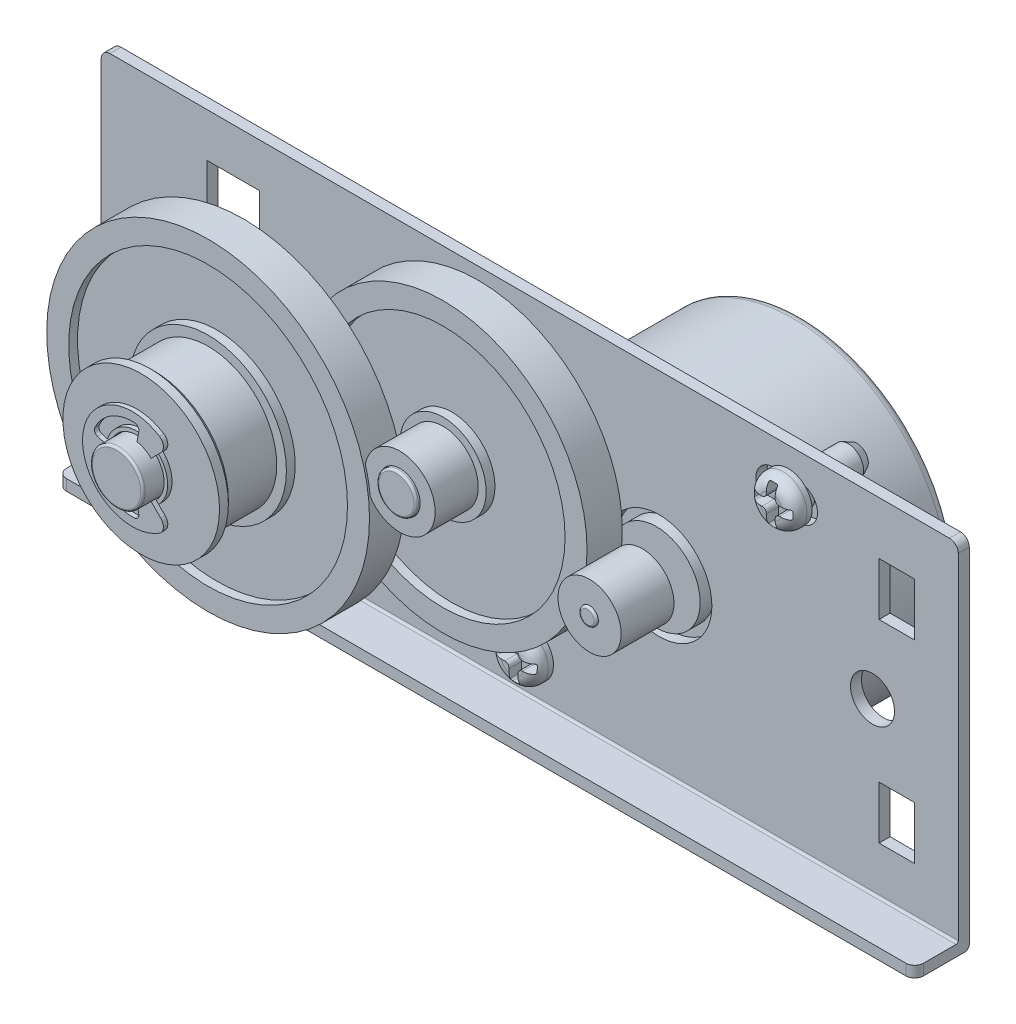
from build123d import *
from OCP.BRepFilletAPI import BRepFilletAPI_MakeChamfer

# Parameters (mm, degrees)
ESBO_O1_W                  = 97.4
ESBO_O1_H                  = 1.25
RESSALTO_EXTRUS_O1_DEPTH   = 6.2
ESBO_O2_W                  = 97.4
ESBO_O2_H                  = 1.25
RESSALTO_EXTRUS_O2_DEPTH   = 40.6
FILETE1_R                  = 1
ESBO_O3_R                  = 2
ESBO_O3_R_2                = 2.5
ESBO_O3_R_3                = 6
ESBO_O3_W                  = 4
ESBO_O3_H                  = 6
ESBO_O3_W_2                = 6
ESBO_O3_H_2                = 8
CORTE_EXTRUS_O1_DEPTH      = 40.6
ESBO_O6_R                  = 3
RESSALTO_EXTRUS_O3_DEPTH   = 22.5
ESBO_O7_R                  = 2.25
RESSALTO_EXTRUS_O4_DEPTH   = 12.3
FILETE2_R                  = 0.25
ESBO_O12_R                 = 4
RESSALTO_EXTRUS_O7_DEPTH   = 3
ESBO_O13_R                 = 4.5
RESSALTO_EXTRUS_O8_DEPTH   = 8.1
ESBO_O8_R                  = 16.365
ESBO_O8_R_2                = 2.3
RESSALTO_EXTRUS_O5_DEPTH   = 4
ESBO_O9_R                  = 4
ESBO_O9_R_2                = 2.3
RESSALTO_EXTRUS_O6_DEPTH   = 8.9
ESBO_O10_R                 = 13.865
ESBO_O10_R_2               = 4.9
CORTE_EXTRUS_O2_DEPTH      = 1
CORTE_EXTRUS_O3_START      = -1
ESBO_O11_R                 = 13.86
ESBO_O11_R_2               = 4.9
CORTE_EXTRUS_O3_DEPTH      = 1
ESBO_O14_R                 = 18.34
ESBO_O14_R_2               = 3.1
RESSALTO_EXTRUS_O9_DEPTH   = 4
ESBO_O15_R                 = 7.8
ESBO_O15_R_2               = 3.1
RESSALTO_EXTRUS_O10_DEPTH  = 11.6
RESSALTO_EXTRUS_O11_START  = -1.5
ESBO_O16_R                 = 8.9
ESBO_O16_R_2               = 3.1
RESSALTO_EXTRUS_O11_DEPTH  = 1.5
CHANFRO1_SIZE              = 0.5
ESBO_O17_R                 = 3.5
ESBO_O17_R_2               = 3.1
RESSALTO_EXTRUS_O12_DEPTH  = 0.5
CORTE_EXTRUS_O4_START      = -1
ESBO_O18_R                 = 15.84
ESBO_O18_R_2               = 8.9
CORTE_EXTRUS_O4_DEPTH      = 1
ESBO_O19_R                 = 15.825
ESBO_O19_R_2               = 8.9
CORTE_EXTRUS_O5_DEPTH      = 1
RESSALTO_EXTRUS_O13_DEPTH  = 0.5
ESBO_O21_R                 = 1.75
RESSALTO_EXTRUS_O14_DEPTH  = 0.92
ESBO_O23_R                 = 17.675026778
RESSALTO_EXTRUS_O15_DEPTH  = 15
FILETE4_R                  = 1
ESBO_O24_R                 = 2.05
ESBO_O24_R_2               = 1.75
RESSALTO_EXTRUS_O16_DEPTH  = 1
ESBO_O25_R                 = 2.5
RESSALTO_EXTRUS_O17_DEPTH  = 0.1
ESBO_O26_R                 = 1
RESSALTO_EXTRUS_O18_DEPTH  = 0.5
FILETE6_R                  = 0.1
ESBO_O27_R                 = 4.99
RESSALTO_EXTRUS_O19_DEPTH  = 16.57
RESSALTO_EXTRUS_O20_START  = -25
ESBO_O28_R                 = 1
RESSALTO_EXTRUS_O20_DEPTH  = 25
FILETE5_R                  = 0.25
ESBO_O29_R                 = 3.59
RESSALTO_EXTRUS_O21_DEPTH  = 6
ESBO_O30_R                 = 2.7
RESSALTO_EXTRUS_O22_DEPTH  = 2
FILETE7_R                  = 1.4
CORTE_EXTRUS_O6_DEPTH      = 1.4
ESBO_O32_R                 = 1.75
RESSALTO_EXTRUS_O23_DEPTH  = 7.8
CHANFRO2_SIZE              = 1
CHANFRO2_SIZE2             = 0.466307658
RESSALTO_EXTRUS_O24_DEPTH  = 10
ESBO_O34_R                 = 2
RESSALTO_EXTRUS_O25_DEPTH  = 5
ESBO_O35_R                 = 7.8
RESSALTO_EXTRUS_O26_DEPTH  = 7.6
ESBO_O37_R                 = 8.9
RESSALTO_EXTRUS_O27_DEPTH  = 1.5
CHANFRO3_SIZE              = 0.5
ESBO_O38_R                 = 8.9
RESSALTO_EXTRUS_O28_DEPTH  = 1.5
CORTE_EXTRUS_O7_DEPTH      = 16
CORTE_EXTRUS_O7_DEPTH_BACK = 35.5
ESBO_O39_R                 = 3.05
ESBO_O40_R                 = 4
RESSALTO_EXTRUS_O29_DEPTH  = 6
ESBO_O41_R                 = 3
RESSALTO_EXTRUS_O30_DEPTH  = 18.5
FILETE8_R                  = 0.25
RESSALTO_EXTRUS_O31_DEPTH  = 0.5
RESSALTO_EXTRUS_O32_DEPTH  = 1.2
FILETE9_R                  = 2
FILETE10_R                 = 0.3
FILETE11_R                 = 0.5
FILETE12_R                 = 0.25


with BuildPart() as part:
    # Esboço1 → Ressalto-extrusão1 (new body)
    with BuildSketch(Plane.XY):
        Rectangle(ESBO_O1_W, ESBO_O1_H)
    extrude(amount=RESSALTO_EXTRUS_O1_DEPTH)

    # Esboço2 → Ressalto-extrusão2 (add)
    with BuildSketch(Plane(origin=(0, -0.625, 0), x_dir=(1, 0, 0), z_dir=(0, 1, 0))):
        with Locations((0, -0.625)):
            Rectangle(ESBO_O2_W, ESBO_O2_H)
    extrude(amount=RESSALTO_EXTRUS_O2_DEPTH)

    # Filete1
    filete1_edges = [part.edges().sort_by_distance(p)[0] for p in [
        (48.7, 0, 6.2),
        (48.7, 39.975, 0.625),
        (-48.7, 39.975, 0.625),
        (-48.7, 0, 6.2),
    ]]
    fillet(filete1_edges, radius=FILETE1_R)

    # Esboço3 → Corte-extrusão1 (cut)
    with BuildSketch(Plane.XY.offset(1.25)):
        with Locations((-43.7, 4.975)):
            Circle(ESBO_O3_R)
        with Locations((0, 4.975)):
            Circle(ESBO_O3_R)
        with Locations((38.95, 19.8)):
            Circle(ESBO_O3_R_2)
        with Locations((14.7, 19.8)):
            Circle(ESBO_O3_R_3)
        with Locations((41.7, 30.975)):
            Rectangle(ESBO_O3_W, ESBO_O3_H)
        with Locations((41.7, 8.975)):
            Rectangle(ESBO_O3_W, ESBO_O3_H)
        with Locations((-33.7, 8.975)):
            Rectangle(ESBO_O3_W_2, ESBO_O3_H_2)
        with BuildLine():
            Line((27.7, 36.975), (30.7, 36.975))
            ThreePointArc((30.7, 36.975), (32.7, 34.975), (30.7, 32.975))
            Line((30.7, 32.975), (27.7, 32.975))
            ThreePointArc((27.7, 32.975), (25.7, 34.975), (27.7, 36.975))
        make_face()
        with Locations((-33.7, 30.975)):
            Rectangle(ESBO_O3_W_2, ESBO_O3_H_2)
    extrude(amount=-CORTE_EXTRUS_O1_DEPTH, mode=Mode.SUBTRACT)

    # Esboço6 → Ressalto-extrusão3 (add)
    with BuildSketch(Plane(origin=(0, 0, 0), x_dir=(-1, 0, 0), z_dir=(0, 0, -1))):
        with Locations((25.7, 19.8)):
            Circle(ESBO_O6_R)
    extrude(amount=-RESSALTO_EXTRUS_O3_DEPTH)

    # Esboço7 → Ressalto-extrusão4 (add)
    with BuildSketch(Plane(origin=(0, 0, 0), x_dir=(-1, 0, 0), z_dir=(0, 0, -1))):
        with Locations((4.1, 23.975)):
            Circle(ESBO_O7_R)
    extrude(amount=-RESSALTO_EXTRUS_O4_DEPTH)

    # Filete2
    filete2_edges = [part.edges().sort_by_distance(p)[0] for p in [
        (-22.7, 19.8, 22.5),
        (-1.85, 23.975, 12.3),
    ]]
    fillet(filete2_edges, radius=FILETE2_R)

    # Esboço12 → Ressalto-extrusão7 (add)
    with BuildSketch(Plane.XY):
        with Locations(Location((-4.1, 23.975, 0), (0, 0, 180))):
            Circle(ESBO_O12_R)
    extrude(amount=RESSALTO_EXTRUS_O7_DEPTH)

    # Esboço13 → Ressalto-extrusão8 (add)
    with BuildSketch(Plane(origin=(0, 0, 0), x_dir=(-1, 0, 0), z_dir=(0, 0, -1))):
        with Locations((25.7, 19.8)):
            Circle(ESBO_O13_R)
    extrude(amount=-RESSALTO_EXTRUS_O8_DEPTH)

    # Esboço8 → Ressalto-extrusão5 (add)
    with BuildSketch(Plane.XY.offset(3)):
        with Locations((-4.1, 23.975)):
            Circle(ESBO_O8_R)
        with Locations((-4.1, 23.975)):
            Circle(ESBO_O8_R_2, mode=Mode.SUBTRACT)
    extrude(amount=RESSALTO_EXTRUS_O5_DEPTH)

    # Esboço9 → Ressalto-extrusão6 (add)
    with BuildSketch(Plane.XY.offset(3)):
        with Locations(Location((-4.1, 23.975, 0), (0, 0, 180))):
            Circle(ESBO_O9_R)
        with Locations((-4.1, 23.975)):
            Circle(ESBO_O9_R_2, mode=Mode.SUBTRACT)
    extrude(amount=RESSALTO_EXTRUS_O6_DEPTH)

    # Esboço10 → Corte-extrusão2 (cut)
    with BuildSketch(Plane.XY.offset(7)):
        with Locations((-4.1, 23.975)):
            Circle(ESBO_O10_R)
        with Locations((-4.1, 23.975)):
            Circle(ESBO_O10_R_2, mode=Mode.SUBTRACT)
    extrude(amount=-CORTE_EXTRUS_O2_DEPTH, mode=Mode.SUBTRACT)

    # Esboço11 → Corte-extrusão3 (cut)
    with BuildSketch(Plane(origin=(0, 0, 3), x_dir=(-1, 0, 0), z_dir=(0, 0, -1)).offset(CORTE_EXTRUS_O3_START)):
        with Locations((4.1, 23.975)):
            Circle(ESBO_O11_R)
        with Locations(Location((4.1, 23.975, 0), (0, 0, 180))):
            Circle(ESBO_O11_R_2, mode=Mode.SUBTRACT)
    extrude(amount=CORTE_EXTRUS_O3_DEPTH, mode=Mode.SUBTRACT)

    # Esboço14 → Ressalto-extrusão9 (add)
    with BuildSketch(Plane.XY.offset(8.1)):
        with Locations(Location((-25.7, 19.8, 0), (0, 0, 15.545528491))):
            Circle(ESBO_O14_R)
        with Locations((-25.7, 19.8)):
            Circle(ESBO_O14_R_2, mode=Mode.SUBTRACT)
    extrude(amount=RESSALTO_EXTRUS_O9_DEPTH)

    # Esboço15 → Ressalto-extrusão10 (add)
    with BuildSketch(Plane.XY.offset(8.1)):
        with Locations((-25.7, 19.8)):
            Circle(ESBO_O15_R)
        with Locations((-25.7, 19.8)):
            Circle(ESBO_O15_R_2, mode=Mode.SUBTRACT)
    extrude(amount=RESSALTO_EXTRUS_O10_DEPTH)

    # Esboço16 → Ressalto-extrusão11 (add)
    with BuildSketch(Plane.XY.offset(19.7).offset(RESSALTO_EXTRUS_O11_START)):
        with Locations((-25.7, 19.8)):
            Circle(ESBO_O16_R)
        with Locations((-25.7, 19.8)):
            Circle(ESBO_O16_R_2, mode=Mode.SUBTRACT)
    extrude(amount=RESSALTO_EXTRUS_O11_DEPTH)

    # Chanfro1
    chanfro1_edges = [part.edges().sort_by_distance(p)[0] for p in [
        (-34.6, 19.8, 18.2),
    ]]
    chamfer(chanfro1_edges, length=CHANFRO1_SIZE)

    # Esboço17 → Ressalto-extrusão12 (add)
    with BuildSketch(Plane.XY.offset(19.7)):
        with Locations((-25.7, 19.8)):
            Circle(ESBO_O17_R)
        with Locations((-25.7, 19.8)):
            Circle(ESBO_O17_R_2, mode=Mode.SUBTRACT)
    extrude(amount=RESSALTO_EXTRUS_O12_DEPTH)

    # Esboço18 → Corte-extrusão4 (cut)
    with BuildSketch(Plane.XY.offset(12.1).offset(CORTE_EXTRUS_O4_START)):
        with Locations((-25.7, 19.8)):
            Circle(ESBO_O18_R)
        with Locations((-25.7, 19.8)):
            Circle(ESBO_O18_R_2, mode=Mode.SUBTRACT)
    extrude(amount=CORTE_EXTRUS_O4_DEPTH, mode=Mode.SUBTRACT)

    # Esboço19 → Corte-extrusão5 (cut)
    with BuildSketch(Plane(origin=(0, 0, 8.1), x_dir=(-1, 0, 0), z_dir=(0, 0, -1))):
        with Locations((25.7, 19.8)):
            Circle(ESBO_O19_R)
        with Locations(Location((25.7, 19.8, 0), (0, 0, 180))):
            Circle(ESBO_O19_R_2, mode=Mode.SUBTRACT)
    extrude(amount=-CORTE_EXTRUS_O5_DEPTH, mode=Mode.SUBTRACT)

    # Esboço20 → Ressalto-extrusão13 (add)
    with BuildSketch(Plane.XY.offset(20.2)):
        with BuildLine():
            Line((-28.322721615, 20.626940949), (-29.67498238, 21.05330713))
            ThreePointArc((-29.67498238, 21.05330713), (-29.981119219, 21.326162864), (-29.980184512, 21.736247175))
            ThreePointArc((-29.980184512, 21.736247175), (-28.137076875, 23.816178393), (-25.441102958, 24.490629478))
            ThreePointArc((-25.441102958, 24.490629478), (-25.076922131, 24.302102712), (-24.9762544, 23.904565262))
            Line((-24.9762544, 23.904565262), (-25.222467511, 22.508221321))
            ThreePointArc((-25.222467511, 22.508221321), (-24.430191314, 22.239279791), (-23.755456352, 21.744543648))
            Line((-23.755456352, 21.744543648), (-22.474650348, 23.025349652))
            ThreePointArc((-22.474650348, 23.025349652), (-22.187573749, 23.840156974), (-22.642480013, 24.574584803))
            ThreePointArc((-22.642480013, 24.574584803), (-31.36966388, 19.8), (-22.642480013, 15.025415197))
            ThreePointArc((-22.642480013, 15.025415197), (-22.187573749, 15.759843026), (-22.474650348, 16.574650348))
            Line((-22.474650348, 16.574650348), (-23.755456352, 17.855456352))
            ThreePointArc((-23.755456352, 17.855456352), (-24.430191314, 17.360720209), (-25.222467511, 17.091778679))
            Line((-25.222467511, 17.091778679), (-24.9762544, 15.695434738))
            ThreePointArc((-24.9762544, 15.695434738), (-25.076922131, 15.297897288), (-25.441102958, 15.109370522))
            ThreePointArc((-25.441102958, 15.109370522), (-28.137076875, 15.783821607), (-29.980184512, 17.863752825))
            ThreePointArc((-29.980184512, 17.863752825), (-29.981119219, 18.273837136), (-29.67498238, 18.54669287))
            Line((-29.67498238, 18.54669287), (-28.322721615, 18.973059051))
            ThreePointArc((-28.322721615, 18.973059051), (-28.45, 19.8), (-28.322721615, 20.626940949))
        make_face()
    extrude(amount=RESSALTO_EXTRUS_O13_DEPTH)

    # Esboço21 → Ressalto-extrusão14 (add)
    with BuildSketch(Plane(origin=(0, 0, 0), x_dir=(-1, 0, 0), z_dir=(0, 0, -1))):
        with BuildLine():
            Line((3.595164465, 5.161527392), (2.779555471, 20.88173038))
            ThreePointArc((2.779555471, 20.88173038), (-2.196938457, 32.222448714), (-13.433733778, 37.429349428))
            Line((-13.433733778, 37.429349428), (-29.134017665, 38.565609025))
            ThreePointArc((-29.134017665, 38.565609025), (-31.845866586, 37.610857858), (-32.993876913, 34.975))
            Line((-32.993876913, 34.975), (-32.993876913, 30.076020514))
            Line((-32.993876913, 30.076020514), (-30.487753652, 27.518219171))
            ThreePointArc((-30.487753652, 27.518219171), (-27.196938457, 7.727551286), (-7.477551833, 4.033530282))
            Line((-7.477551833, 4.033530282), (-4.87273477, 1.375))
            Line((-4.87273477, 1.375), (0, 1.375))
            ThreePointArc((0, 1.375), (2.610699007, 2.49624009), (3.595164465, 5.161527392))
        make_face()
        with Locations((0, 4.975)):
            Circle(ESBO_O21_R, mode=Mode.SUBTRACT)
        with Locations((-29.393876913, 34.975)):
            Circle(ESBO_O21_R, mode=Mode.SUBTRACT)
    extrude(amount=RESSALTO_EXTRUS_O14_DEPTH)

    # Esboço23 → Ressalto-extrusão15 (add)
    with BuildSketch(Plane.XY):
        with Locations((14.7, 19.8)):
            Circle(ESBO_O23_R)
    extrude(amount=-RESSALTO_EXTRUS_O15_DEPTH)

    # Filete4
    filete4_edges = [part.edges().sort_by_distance(p)[0] for p in [
        (-2.975026778, 19.8, -15),
    ]]
    fillet(filete4_edges, radius=FILETE4_R)

    # Esboço24 → Ressalto-extrusão16 (add)
    # profile 1 of 2: a face of its own
    with BuildSketch(Plane(origin=(0, 0, -0.92), x_dir=(-1, 0, 0), z_dir=(0, 0, -1))):
        with Locations((0, 4.975)):
            Circle(ESBO_O24_R)
        with Locations((0, 4.975)):
            Circle(ESBO_O24_R_2, mode=Mode.SUBTRACT)
    # profile 2 of 2: a face of its own
    with BuildSketch(Plane(origin=(0, 0, -0.92), x_dir=(-1, 0, 0), z_dir=(0, 0, -1))):
        with Locations((-29.393876913, 34.975)):
            Circle(ESBO_O24_R)
        with Locations((-29.393876913, 34.975)):
            Circle(ESBO_O24_R_2, mode=Mode.SUBTRACT)
    extrude(amount=RESSALTO_EXTRUS_O16_DEPTH)

    # Esboço25 → Ressalto-extrusão17 (add)
    with BuildSketch(Plane(origin=(0, 0, -15), x_dir=(-1, 0, 0), z_dir=(0, 0, -1))):
        with Locations(Location((-14.7, 19.8, 0), (0, 0, 180))):
            Circle(ESBO_O25_R)
    extrude(amount=RESSALTO_EXTRUS_O17_DEPTH)

    # Esboço26 → Ressalto-extrusão18 (add)
    with BuildSketch(Plane(origin=(0, 0, -15.1), x_dir=(-1, 0, 0), z_dir=(0, 0, -1))):
        with Locations((-14.7, 19.8)):
            Circle(ESBO_O26_R)
    extrude(amount=RESSALTO_EXTRUS_O18_DEPTH)

    # Filete6
    filete6_edges = [part.edges().sort_by_distance(p)[0] for p in [
        (12.2, 19.8, -15.1),
    ]]
    fillet(filete6_edges, radius=FILETE6_R - 0.0001)  # a hair under: the kernel refuses the full size

    # Esboço27 → Ressalto-extrusão19 (add)
    with BuildSketch(Plane.XY.offset(-15)):
        with Locations(Location((14.7, 19.8, 0), (0, 0, 180))):
            Circle(ESBO_O27_R)
    extrude(amount=RESSALTO_EXTRUS_O19_DEPTH)

    # Esboço28 → Ressalto-extrusão20 (add)
    with BuildSketch(Plane(origin=(0, 0, -15.6), x_dir=(-1, 0, 0), z_dir=(0, 0, -1)).offset(RESSALTO_EXTRUS_O20_START)):
        with Locations((-14.7, 19.8)):
            Circle(ESBO_O28_R)
    extrude(amount=RESSALTO_EXTRUS_O20_DEPTH)

    # Filete5
    filete5_edges = [part.edges().sort_by_distance(p)[0] for p in [
        (15.7, 19.8, -15.6),
        (15.7, 19.8, 9.4),
    ]]
    fillet(filete5_edges, radius=FILETE5_R)

    # Esboço29 → Ressalto-extrusão21 (add)
    with BuildSketch(Plane.XY.offset(9.15)):
        with Locations((14.7, 19.8)):
            Circle(ESBO_O29_R)
    extrude(amount=-RESSALTO_EXTRUS_O21_DEPTH)

    # Esboço30 → Ressalto-extrusão22 (add)
    with BuildSketch(Plane.XY.offset(1.25)):
        with Locations(Location((0, 4.975, 0), (0, 0, 180))):
            Circle(ESBO_O30_R)
        with Locations(Location((29.393876913, 34.975, 0), (0, 0, 227.672748848))):
            Circle(ESBO_O30_R)
    extrude(amount=RESSALTO_EXTRUS_O22_DEPTH)

    # Filete7
    filete7_edges = [part.edges().sort_by_distance(p)[0] for p in [
        (2.7, 4.975, 3.25),
        (31.211960314, 36.971139461, 3.25),
    ]]
    fillet(filete7_edges, radius=FILETE7_R)

    # Esboço31 → Corte-extrusão6 (cut)
    with BuildSketch(Plane.XY.offset(3.25)):
        with BuildLine():
            Line((29.093876913, 37.175), (29.693876913, 37.175))
            ThreePointArc((29.693876913, 37.175), (29.83529827, 37.116421356), (29.893876913, 36.975))
            Line((29.893876913, 36.975), (29.893876913, 35.975))
            ThreePointArc((29.893876913, 35.975), (30.040323523, 35.621446609), (30.393876913, 35.475))
            Line((30.393876913, 35.475), (31.393876913, 35.475))
            ThreePointArc((31.393876913, 35.475), (31.53529827, 35.416421356), (31.593876913, 35.275))
            Line((31.593876913, 35.275), (31.593876913, 34.675))
            ThreePointArc((31.593876913, 34.675), (31.53529827, 34.533578644), (31.393876913, 34.475))
            Line((31.393876913, 34.475), (30.393876913, 34.475))
            ThreePointArc((30.393876913, 34.475), (30.040323523, 34.328553391), (29.893876913, 33.975))
            Line((29.893876913, 33.975), (29.893876913, 32.975))
            ThreePointArc((29.893876913, 32.975), (29.83529827, 32.833578644), (29.693876913, 32.775))
            Line((29.693876913, 32.775), (29.093876913, 32.775))
            ThreePointArc((29.093876913, 32.775), (28.952455557, 32.833578644), (28.893876913, 32.975))
            Line((28.893876913, 32.975), (28.893876913, 33.975))
            ThreePointArc((28.893876913, 33.975), (28.747430304, 34.328553391), (28.393876913, 34.475))
            Line((28.393876913, 34.475), (27.393876913, 34.475))
            ThreePointArc((27.393876913, 34.475), (27.252455557, 34.533578644), (27.193876913, 34.675))
            Line((27.193876913, 34.675), (27.193876913, 35.275))
            ThreePointArc((27.193876913, 35.275), (27.252455557, 35.416421356), (27.393876913, 35.475))
            Line((27.393876913, 35.475), (28.393876913, 35.475))
            ThreePointArc((28.393876913, 35.475), (28.747430304, 35.621446609), (28.893876913, 35.975))
            Line((28.893876913, 35.975), (28.893876913, 36.975))
            ThreePointArc((28.893876913, 36.975), (28.952455557, 37.116421356), (29.093876913, 37.175))
        make_face()
        with BuildLine():
            Line((-0.142061447, 7.325028719), (0.457938553, 7.325028719))
            ThreePointArc((0.457938553, 7.325028719), (0.59935991, 7.266450075), (0.657938553, 7.125028719))
            Line((0.657938553, 7.125028719), (0.657938553, 6.125028719))
            ThreePointArc((0.657938553, 6.125028719), (0.804385163, 5.771475328), (1.157938553, 5.625028719))
            Line((1.157938553, 5.625028719), (2.157938553, 5.625028719))
            ThreePointArc((2.157938553, 5.625028719), (2.29935991, 5.566450075), (2.357938553, 5.425028719))
            Line((2.357938553, 5.425028719), (2.357938553, 4.825028719))
            ThreePointArc((2.357938553, 4.825028719), (2.29935991, 4.683607363), (2.157938553, 4.625028719))
            Line((2.157938553, 4.625028719), (1.157938553, 4.625028719))
            ThreePointArc((1.157938553, 4.625028719), (0.804385163, 4.478582109), (0.657938553, 4.125028719))
            Line((0.657938553, 4.125028719), (0.657938553, 3.125028719))
            ThreePointArc((0.657938553, 3.125028719), (0.59935991, 2.983607363), (0.457938553, 2.925028719))
            Line((0.457938553, 2.925028719), (-0.142061447, 2.925028719))
            ThreePointArc((-0.142061447, 2.925028719), (-0.283482803, 2.983607363), (-0.342061447, 3.125028719))
            Line((-0.342061447, 3.125028719), (-0.342061447, 4.125028719))
            ThreePointArc((-0.342061447, 4.125028719), (-0.488508056, 4.478582109), (-0.842061447, 4.625028719))
            Line((-0.842061447, 4.625028719), (-1.842061447, 4.625028719))
            ThreePointArc((-1.842061447, 4.625028719), (-1.983482803, 4.683607363), (-2.042061447, 4.825028719))
            Line((-2.042061447, 4.825028719), (-2.042061447, 5.425028719))
            ThreePointArc((-2.042061447, 5.425028719), (-1.983482803, 5.566450075), (-1.842061447, 5.625028719))
            Line((-1.842061447, 5.625028719), (-0.842061447, 5.625028719))
            ThreePointArc((-0.842061447, 5.625028719), (-0.488508056, 5.771475328), (-0.342061447, 6.125028719))
            Line((-0.342061447, 6.125028719), (-0.342061447, 7.125028719))
            ThreePointArc((-0.342061447, 7.125028719), (-0.283482803, 7.266450075), (-0.142061447, 7.325028719))
        make_face()
    extrude(amount=-CORTE_EXTRUS_O6_DEPTH, mode=Mode.SUBTRACT)

    # Esboço32 → Ressalto-extrusão23 (add)
    with BuildSketch(Plane(origin=(0, 0, 1.25), x_dir=(-1, 0, 0), z_dir=(0, 0, -1))):
        with Locations((0, 4.975)):
            Circle(ESBO_O32_R)
        with Locations(Location((-29.393876913, 34.975, 0), (0, 0, 180))):
            Circle(ESBO_O32_R)
    extrude(amount=RESSALTO_EXTRUS_O23_DEPTH)

    # Chanfro2: one chamfer whose edges measure the first distance from different faces: ONE call of the kernel's chamfer builder (chamfer() names one face for all edges)
    chanfro2_edges_1 = [part.edges().sort_by_distance(p)[0] for p in [
        (1.75, 4.975, -6.55),
    ]]
    chanfro2_side_1 = [part.faces().sort_by_distance(p)[0] for p in [
        (1.75, 4.975, -4.235),
    ]]
    chanfro2_edges_2 = [part.edges().sort_by_distance(p)[0] for p in [
        (27.643876913, 34.975, -6.55),
    ]]
    chanfro2_side_2 = [part.faces().sort_by_distance(p)[0] for p in [
        (27.643876913, 34.975, -4.235),
    ]]
    chanfro2 = BRepFilletAPI_MakeChamfer(part.part.solid().wrapped)
    for e in chanfro2_edges_1:
        chanfro2.Add(CHANFRO2_SIZE, CHANFRO2_SIZE2, e.wrapped, chanfro2_side_1[0].wrapped)  # the first distance lies on this face
    for e in chanfro2_edges_2:
        chanfro2.Add(CHANFRO2_SIZE, CHANFRO2_SIZE2, e.wrapped, chanfro2_side_2[0].wrapped)  # the first distance lies on this face
    add(Compound.cast(chanfro2.Shape()), mode=Mode.REPLACE)

    # Esboço33 → Ressalto-extrusão24 (add)
    with BuildSketch(Plane(origin=(0, 0, -0.92), x_dir=(-1, 0, 0), z_dir=(0, 0, -1))):
        with BuildLine():
            Line((3.196311276, 12.849099671), (3.224269109, 12.846096875))
            Line((3.224269109, 12.846096875), (4.292171901, 22.788912554))
            Line((4.292171901, 22.788912554), (2.690076099, 22.960984796))
            ThreePointArc((2.690076099, 22.960984796), (2.95476648, 20.646044994), (2.912651997, 18.316402606))
            Line((2.912651997, 18.316402606), (3.196311276, 12.849099671))
        make_face()
        with BuildLine():
            Line((1.622173307, 13.018169117), (3.196311276, 12.849099671))
            Line((3.196311276, 12.849099671), (2.912651997, 18.316402606))
            ThreePointArc((2.912651997, 18.316402606), (2.472970379, 15.617218633), (1.622173307, 13.018169117))
        make_face()
    extrude(amount=RESSALTO_EXTRUS_O24_DEPTH)

    # Esboço34 → Ressalto-extrusão25 (add)
    with BuildSketch(Plane(origin=(-1.823505509, -0.195852632, 0), x_dir=(0, 0, 1), z_dir=(-0.9942815679049348, -0.10679027916671441, 0))):
        with Locations(Location((-5.92, 18.116957941, 0), (0, 0, 270))):
            Circle(ESBO_O34_R)
    extrude(amount=RESSALTO_EXTRUS_O25_DEPTH)

    # Filete11
    filete11_edges = [part.edges().sort_by_distance(p)[0] for p in [
        (0, -0.625, 0),
    ]]
    fillet(filete11_edges, radius=FILETE11_R)

    # Filete12
    filete12_edges = [part.edges().sort_by_distance(p)[0] for p in [
        (0, 0.625, 1.25),
    ]]
    fillet(filete12_edges, radius=FILETE12_R)


with BuildPart() as body_2:
    # Esboço35 → Ressalto-extrusão26 (new body)
    with BuildSketch(Plane.XY.offset(12.1)):
        with Locations(Location((-398.7, 19.8, 0), (0, 0, 180))):
            Circle(ESBO_O35_R)
    extrude(amount=RESSALTO_EXTRUS_O26_DEPTH)

    # Esboço37 → Ressalto-extrusão27 (add)
    with BuildSketch(Plane.XY.offset(19.7)):
        with Locations((-398.7, 19.8)):
            Circle(ESBO_O37_R)
    extrude(amount=-RESSALTO_EXTRUS_O27_DEPTH)

    # Chanfro3
    chanfro3_edges = [body_2.edges().sort_by_distance(p)[0] for p in [
        (-407.6, 19.8, 18.2),
    ]]
    chamfer(chanfro3_edges, length=CHANFRO3_SIZE)

    # Esboço38 → Ressalto-extrusão28 (add)
    with BuildSketch(Plane(origin=(0, 0, 12.1), x_dir=(-1, 0, 0), z_dir=(0, 0, -1))):
        with Locations(Location((398.7, 19.8, 0), (0, 0, 180))):
            Circle(ESBO_O38_R)
    extrude(amount=RESSALTO_EXTRUS_O28_DEPTH)

    # Esboço39 → Corte-extrusão7 (cut, two sides: drawn at the far end of the back side and taken through both)
    with BuildSketch(Plane.XY.offset(19.7).offset(-CORTE_EXTRUS_O7_DEPTH_BACK)):
        with Locations(Location((-398.7, 19.8, 0), (0, 0, 180))):
            Circle(ESBO_O39_R)
    extrude(amount=CORTE_EXTRUS_O7_DEPTH + CORTE_EXTRUS_O7_DEPTH_BACK, mode=Mode.SUBTRACT)

    # Esboço40 → Ressalto-extrusão29 (add)
    with BuildSketch(Plane(origin=(0, 0, 10.6), x_dir=(-1, 0, 0), z_dir=(0, 0, -1))):
        with Locations((398.7, 19.8)):
            Circle(ESBO_O40_R)
    extrude(amount=RESSALTO_EXTRUS_O29_DEPTH)

    # Esboço41 → Ressalto-extrusão30 (add)
    with BuildSketch(Plane(origin=(0, 0, 4.6), x_dir=(-1, 0, 0), z_dir=(0, 0, -1))):
        with Locations((398.7, 19.8)):
            Circle(ESBO_O41_R)
    extrude(amount=-RESSALTO_EXTRUS_O30_DEPTH)

    # Filete8
    filete8_edges = [body_2.edges().sort_by_distance(p)[0] for p in [
        (-395.7, 19.8, 23.1),
    ]]
    fillet(filete8_edges, radius=FILETE8_R)

    # Esboço42 → Ressalto-extrusão31 (add)
    with BuildSketch(Plane.XY.offset(19.7)):
        with BuildLine():
            Line((-401.322721615, 20.626940949), (-402.67498238, 21.05330713))
            ThreePointArc((-402.67498238, 21.05330713), (-402.981119219, 21.326162864), (-402.980184512, 21.736247175))
            ThreePointArc((-402.980184512, 21.736247175), (-401.137076875, 23.816178393), (-398.441102958, 24.490629478))
            ThreePointArc((-398.441102958, 24.490629478), (-398.076922131, 24.302102712), (-397.9762544, 23.904565262))
            Line((-397.9762544, 23.904565262), (-398.222467511, 22.508221321))
            ThreePointArc((-398.222467511, 22.508221321), (-397.430191314, 22.239279791), (-396.755456352, 21.744543648))
            Line((-396.755456352, 21.744543648), (-395.474650348, 23.025349652))
            ThreePointArc((-395.474650348, 23.025349652), (-395.187573749, 23.840156974), (-395.642480013, 24.574584803))
            ThreePointArc((-395.642480013, 24.574584803), (-404.36966388, 19.8), (-395.642480013, 15.025415197))
            ThreePointArc((-395.642480013, 15.025415197), (-395.187573749, 15.759843026), (-395.474650348, 16.574650348))
            Line((-395.474650348, 16.574650348), (-396.755456352, 17.855456352))
            ThreePointArc((-396.755456352, 17.855456352), (-397.430191314, 17.360720209), (-398.222467511, 17.091778679))
            Line((-398.222467511, 17.091778679), (-397.9762544, 15.695434738))
            ThreePointArc((-397.9762544, 15.695434738), (-398.076922131, 15.297897288), (-398.441102958, 15.109370522))
            ThreePointArc((-398.441102958, 15.109370522), (-401.137076875, 15.783821607), (-402.980184512, 17.863752825))
            ThreePointArc((-402.980184512, 17.863752825), (-402.981119219, 18.273837136), (-402.67498238, 18.54669287))
            Line((-402.67498238, 18.54669287), (-401.322721615, 18.973059051))
            ThreePointArc((-401.322721615, 18.973059051), (-401.45, 19.8), (-401.322721615, 20.626940949))
        make_face()
    extrude(amount=RESSALTO_EXTRUS_O31_DEPTH)

    # Esboço43 → Ressalto-extrusão32 (add)
    with BuildSketch(Plane(origin=(0, 0, 4.6), x_dir=(-1, 0, 0), z_dir=(0, 0, -1))):
        Polygon((402.2, 5.8), (402.2, 3.8), (395.2, 3.8), (395.2, 5.8), (388.7, 5.8), (388.7, 29.8), (408.7, 29.8), (408.7, 5.8), align=None)
    extrude(amount=RESSALTO_EXTRUS_O32_DEPTH)

    # Filete9
    filete9_edges = [body_2.edges().sort_by_distance(p)[0] for p in [
        (-408.7, 5.8, 4),
        (-408.7, 29.8, 4),
        (-388.7, 29.8, 4),
        (-388.7, 5.8, 4),
    ]]
    fillet(filete9_edges, radius=FILETE9_R)

    # Filete10
    filete10_edges = [body_2.edges().sort_by_distance(p)[0] for p in [
        (-395.2, 5.8, 4),
        (-402.2, 5.8, 4),
    ]]
    fillet(filete10_edges, radius=FILETE10_R)


solid = part.part
